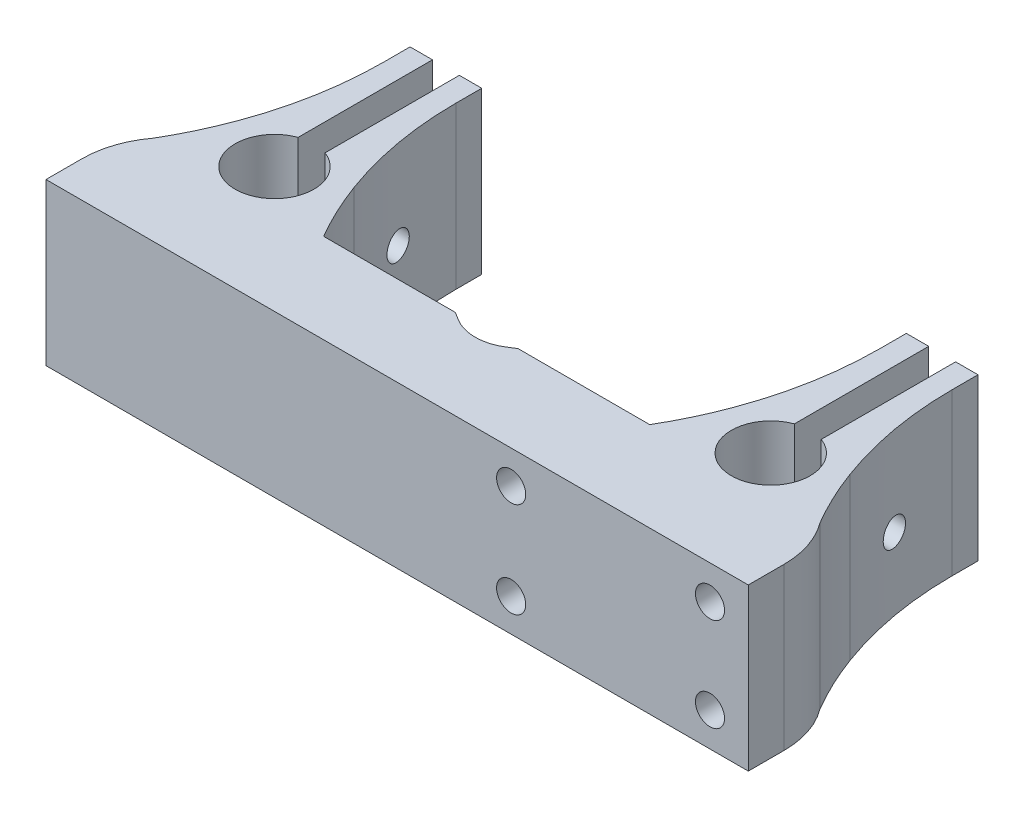
from build123d import *

# Parameters (mm, degrees)
BOSS_EXTRUDE1_DEPTH     = 18
FILLET1_R               = 40
FILLET2_R               = 10
CUT_EXTRUDE1_DEPTH      = 75.41915473
CUT_EXTRUDE1_DEPTH_BACK = 75.41915473
SKETCH8_R               = 1.52
FILLET3_R               = 5
SKETCH13_R              = 1.625
CUT_EXTRUDE6_DEPTH      = 10
SKETCH14_R              = 1.625
CUT_EXTRUDE7_DEPTH      = 10


with BuildPart() as part:
    # Sketch7 → Boss-Extrude1 (new body)
    with BuildSketch(Plane(origin=(0, 0, 0), x_dir=(1, 0, 0), z_dir=(0, 1, 0))):
        with BuildLine():
            Line((3.5, 0), (18.2, 0))
            Line((18.2, 0), (20.800813361, 4.113644998))
            ThreePointArc((20.800813361, 4.113644998), (21.592172613, 7.217756586), (23.7, 9.629980027))
            Line((23.7, 9.629980027), (23.7, 23.144126484))
            Line((23.7, 23.144126484), (26.2, 23.144126484))
            Line((26.2, 23.144126484), (26.2, 8.144126484))
            ThreePointArc((26.2, 8.144126484), (27.7, -0.392297092), (29.2, 8.144126484))
            Line((29.2, 8.144126484), (29.2, 23.144126484))
            Line((29.2, 23.144126484), (31.7, 23.144126484))
            Line((31.7, 23.144126484), (31.7, 9.629980027))
            ThreePointArc((31.7, 9.629980027), (33.807827387, 7.217756586), (34.599186639, 4.113644998))
            Line((34.599186639, 4.113644998), (37.2, 0))
            Line((37.2, 0), (39.2, 0))
            Line((39.2, 0), (39.2, -10))
            Line((39.2, -10), (0, -10))
            Line((0, -10), (0, -2.2))
            Line((0, -2.2), (3.5, 0))
        make_face()
    boss_extrude1 = extrude(amount=BOSS_EXTRUDE1_DEPTH)

    # Mirror1: Boss-Extrude1 across plane
    add(boss_extrude1.mirror(Plane(origin=(0, 18, 10), x_dir=(0, 0, 1), z_dir=(1, 0, 0))))

    # Fillet1
    # the kernel refuses this fillet: 40 mm, written as the material it adds along each edge
    with BuildSketch(Plane(origin=(23.7, 0, -9.629980027), x_dir=(0, 0, -1), z_dir=(0, 1, 0)), Plane(origin=(-31.7, 0, -9.629980027), x_dir=(0, 0, -1), z_dir=(0, 1, 0))) as fillet1_piece_1:
        with BuildLine():
            CenterArc((10.613793835, 40), FILLET1_R, 249.745857862, 20.254142138)
            Line((-3.233601435, 2.473347548), (-3.51054934, 1.722814499))
            ThreePointArc((-3.51054934, 1.722814499), (-1.916270335, 0.845153632), (-0.651858217, -0.463768116))
            Line((-0.651858217, -0.463768116), (0, -0.8))
            Line((0, -0.8), (10.613793835, -0.8))
            Line((10.613793835, -0.8), (10.613793835, 0))
        make_face()
    extrude(amount=18)
    with BuildSketch(Plane(origin=(20.800813361, 0, -4.113644998), x_dir=(0.18333937231858005, 0, -0.9830496806152929), z_dir=(0, 1, 0)), Plane(origin=(-34.599186639, 0, -4.113644998), x_dir=(0.18333937231857603, 0, -0.9830496806152935), z_dir=(0, 1, 0))) as fillet1_piece_2:
        with BuildLine():
            CenterArc((9.050455959, 39.429951175), FILLET1_R, 250.166978756, 10.14844141)
            Line((-4.52074889, 1.802535653), (-4.792172987, 1.049987342))
            ThreePointArc((-4.792172987, 1.049987342), (-2.556670036, 0.158160214), (-0.296295591, -0.743107612))
            Line((-0.296295591, -0.743107612), (0.134579271, -0.788599024))
            ThreePointArc((0.134579271, -0.788599024), (1.16074621, -0.701666578), (2.18691315, -0.788599024))
            Line((2.18691315, -0.788599024), (2.321492421, 0))
        make_face()
    extrude(amount=18)
    with BuildSketch(Plane(origin=(31.7, 0, -9.629980027), x_dir=(0, 0, -1), z_dir=(0, 1, 0))) as fillet1_piece_3:
        with BuildLine():
            CenterArc((10.613793835, -40), FILLET1_R, 90, 20.254142138)
            Line((-3.233601435, -2.473347548), (-3.51054934, -1.722814499))
            ThreePointArc((-3.51054934, -1.722814499), (-1.916270335, -0.845153632), (-0.651858217, 0.463768116))
            Line((-0.651858217, 0.463768116), (0, 0.8))
            Line((0, 0.8), (10.613793835, 0.8))
            Line((10.613793835, 0.8), (10.613793835, 0))
        make_face()
    extrude(amount=18)
    with BuildSketch(Plane(origin=(34.599186639, 0, -4.113644998), x_dir=(0.5343927114747591, 0, 0.8452363160221257), z_dir=(0, 1, 0)), Plane(origin=(-20.800813361, 0, -4.113644998), x_dir=(0.5343927114747586, 0, 0.8452363160221262), z_dir=(0, 1, 0))) as fillet1_piece_4:
        with BuildLine():
            CenterArc((6.196822464, 39.977883812), FILLET1_R, 257.946173426, 10.14844141)
            Line((-2.156398361, 0.859809961), (-2.323462777, 0.077448484))
            ThreePointArc((-2.323462777, 0.077448484), (-1.338075072, -0.221862238), (-0.417081618, -0.682673366))
            Line((-0.417081618, -0.682673366), (0, -0.8))
            ThreePointArc((0, -0.8), (2.433428924, -0.8), (4.840258555, -0.799557676))
            Line((4.840258555, -0.799557676), (4.866857847, 0))
        make_face()
    extrude(amount=18)
    with BuildSketch(Plane(origin=(-23.7, 0, -9.629980027), x_dir=(0.6075420957696648, 0, 0.7942874806188269), z_dir=(0, 1, 0))) as fillet1_piece_5:
        with BuildLine():
            CenterArc((15.871280266, 38.219825775), FILLET1_R, 232.588008111, 20.254142138)
            Line((-8.430403565, 6.44832655), (-8.916437241, 5.812896566))
            Line((-8.916437241, 5.812896566), (-0.486033677, -0.635429984))
            Line((-0.486033677, -0.635429984), (0.236004168, -0.764396516))
            ThreePointArc((0.236004168, -0.764396516), (2.035535945, -0.492919946), (3.835067722, -0.764396516))
            Line((3.835067722, -0.764396516), (4.07107189, 0))
        make_face()
    extrude(amount=18)

    # Fillet2
    # the kernel refuses this fillet: 10 mm, written as the material it takes off along each edge
    with BuildSketch(Plane(origin=(-39.2, -15, 0), x_dir=(1, 0, 0), z_dir=(0, 1, 0))) as fillet2_piece_1:
        with BuildLine():
            CenterArc((10, -6), FILLET2_R, 143.130102354, 36.869897646)
            Line((0, -6), (-0.2, -6))
            Line((-0.2, -6), (-0.2, 0))
            Line((-0.2, 0), (0, 0.2))
            ThreePointArc((0, 0.2), (1, 0.2), (1.84, 0.12))
            Line((1.84, 0.12), (2, 0))
        make_face()
    extrude(amount=48, mode=Mode.SUBTRACT)
    with BuildSketch(Plane(origin=(39.2, -15, 0), x_dir=(0, 0, 1), z_dir=(0, 1, 0))) as fillet2_piece_2:
        with BuildLine():
            CenterArc((6, -10), FILLET2_R, 90, 36.869897646)
            Line((0, -2), (-0.12, -1.84))
            ThreePointArc((-0.12, -1.84), (-0.2, -1), (-0.2, 0))
            Line((-0.2, 0), (0, 0.2))
            Line((0, 0.2), (6, 0.2))
            Line((6, 0.2), (6, 0))
        make_face()
    extrude(amount=48, mode=Mode.SUBTRACT)

    # Sketch8 → Cut-Extrude1 (cut, two sides: drawn at the far end of the back side and taken through both)
    with BuildSketch(Plane.ZY.offset(-29.2).offset(-CUT_EXTRUDE1_DEPTH_BACK)):
        with Locations((-13.144126484, 8.1)):
            Circle(SKETCH8_R)
    extrude(amount=CUT_EXTRUDE1_DEPTH + CUT_EXTRUDE1_DEPTH_BACK, mode=Mode.SUBTRACT)

    # Fillet3
    fillet3_edges = [part.edges().sort_by_distance(p)[0] for p in [
        (0, 9, 2.2),
    ]]
    fillet(fillet3_edges, radius=FILLET3_R)

    # Sketch13 → Cut-Extrude6 (cut)
    with BuildSketch(Plane.XY.offset(10)):
        with Locations((12.725, 3.675)):
            Circle(SKETCH13_R)
        with Locations((34.925, 14.225)):
            Circle(SKETCH13_R)
    extrude(amount=-CUT_EXTRUDE6_DEPTH, mode=Mode.SUBTRACT)

    # Sketch14 → Cut-Extrude7 (cut)
    with BuildSketch(Plane.XY.offset(10)):
        with Locations((12.725, 14.325)):
            Circle(SKETCH14_R)
        with Locations((34.925, 3.775)):
            Circle(SKETCH14_R)
    extrude(amount=-CUT_EXTRUDE7_DEPTH, mode=Mode.SUBTRACT)


solid = part.part
